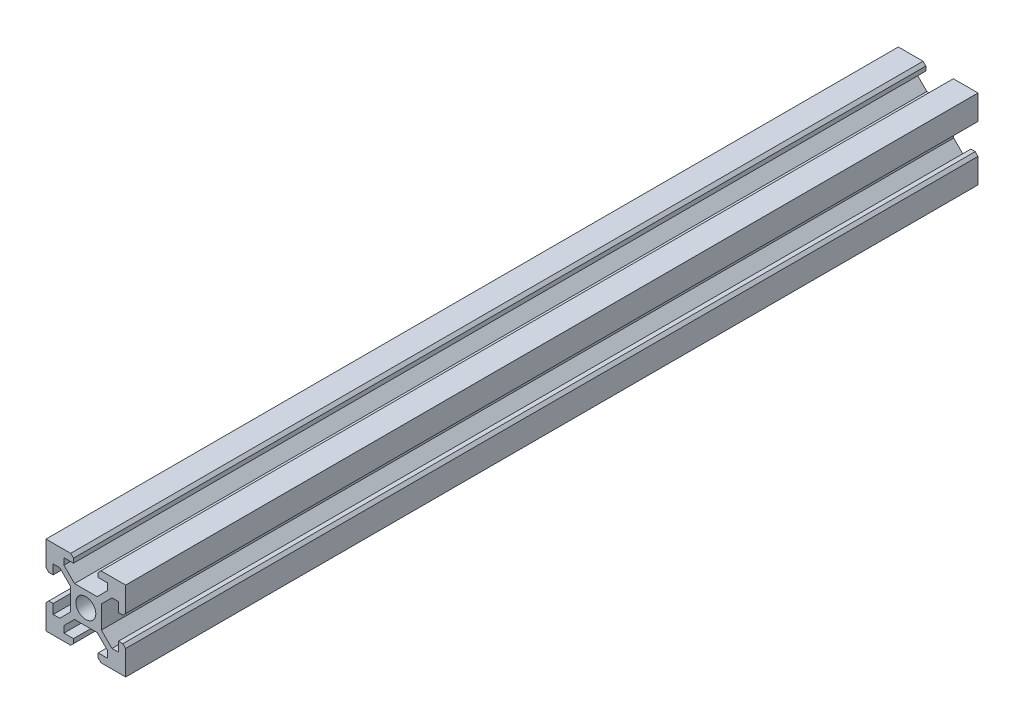
from build123d import *

# Parameters (mm, degrees)
SKETCH1_R           = 2.5
BOSS_EXTRUDE1_DEPTH = 107


with BuildPart() as part:
    # Sketch1 → Boss-Extrude1 (new, symmetric)
    with BuildSketch(Plane.XY):
        Polygon((6.560660172, -5.5), (3.9, -2.839339828), (3.9, 2.839339828), (6.560660172, 5.5), (8.200660172, 5.5), (8.200660172, 3.1), (9.3, 3.1), (10, 3.8), (10, 10), (3.8, 10), (3.1, 9.3), (3.1, 8.200660172), (5.5, 8.200660172), (5.5, 6.560660172), (2.839339828, 3.9), (-2.839339828, 3.9), (-5.5, 6.560660172), (-5.5, 8.200660172), (-3.1, 8.200660172), (-3.1, 9.3), (-3.8, 10), (-10, 10), (-10, 3.8), (-9.3, 3.1), (-8.200660172, 3.1), (-8.200660172, 5.5), (-6.560660172, 5.5), (-3.9, 2.839339828), (-3.9, -2.839339828), (-6.560660172, -5.5), (-8.200660172, -5.5), (-8.200660172, -3.1), (-9.3, -3.1), (-10, -3.8), (-10, -10), (-3.8, -10), (-3.1, -9.3), (-3.1, -8.200660172), (-5.5, -8.200660172), (-5.5, -6.560660172), (-2.839339828, -3.9), (2.839339828, -3.9), (5.5, -6.560660172), (5.5, -8.200660172), (3.1, -8.200660172), (3.1, -9.3), (3.8, -10), (10, -10), (10, -3.8), (9.3, -3.1), (8.200660172, -3.1), (8.200660172, -5.5), align=None)
        Circle(SKETCH1_R, mode=Mode.SUBTRACT)
    extrude(amount=BOSS_EXTRUDE1_DEPTH, both=True)


solid = part.part
